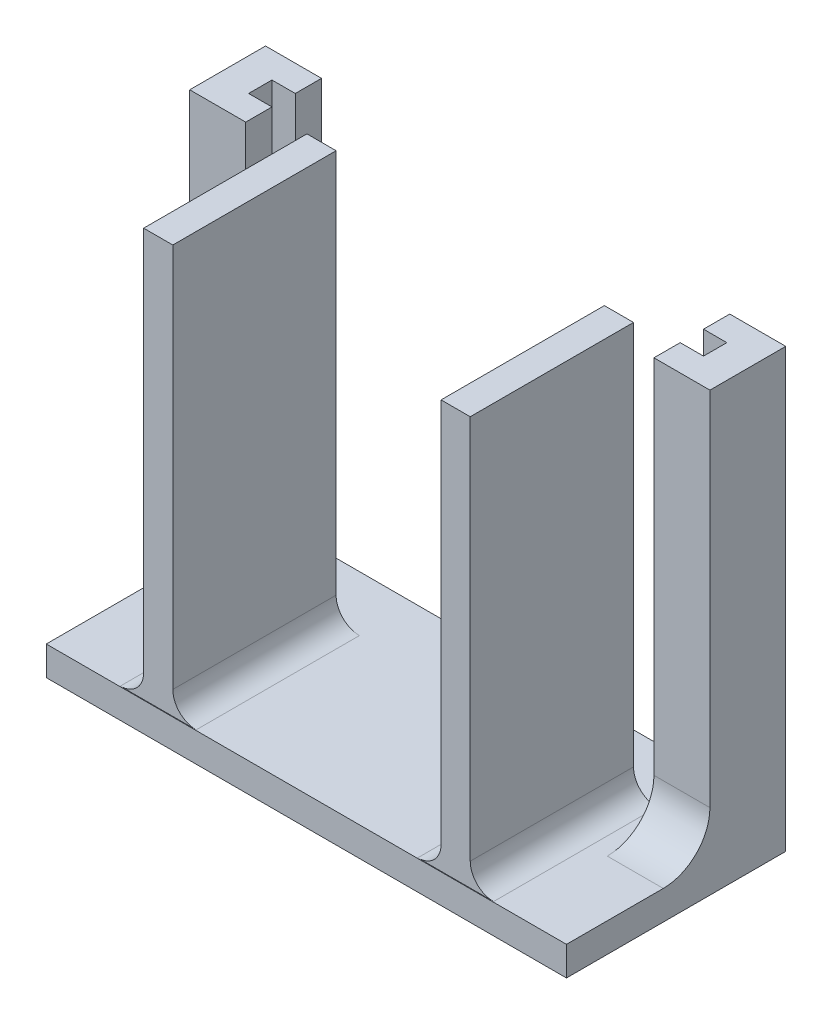
from build123d import *

# Parameters (mm, degrees)
BOSS_EXTRUDE1_DEPTH   = 35
BOSS_EXTRUDE1_2_DEPTH = 35
SKETCH1_W             = 2.5
SKETCH1_H             = 14
BOSS_EXTRUDE1_3_DEPTH = 35
BOSS_EXTRUDE1_4_DEPTH = 35
SKETCH2_W             = 44.6
SKETCH2_H             = 18.8
BOSS_EXTRUDE2_DEPTH   = 2.5
FILLET1_R             = 2
FILLET2_R             = 4


with BuildPart() as part:
    # Sketch1 → Boss-Extrude1 (new body)
    with BuildSketch(Plane(origin=(0, -19, 0), x_dir=(1, 0, 0), z_dir=(0, 1, 0))):
        Polygon((-19.5, 0.5), (-17.5, 0.5), (-17.5, 2.75), (-22.3, 2.75), (-22.3, -3.75), (-17.5, -3.75), (-17.5, -1.5), (-19.5, -1.5), align=None)
    extrude(amount=BOSS_EXTRUDE1_DEPTH)



with BuildPart() as body_2:
    # Sketch1 → Boss-Extrude1 2 (new body)
    with BuildSketch(Plane(origin=(0, -19, 0), x_dir=(1, 0, 0), z_dir=(0, 1, 0))):
        Polygon((19.5, -1.5), (19.5, 0.5), (17.5, 0.5), (17.5, 2.75), (22.3, 2.75), (22.3, -3.75), (17.5, -3.75), (17.5, -1.5), align=None)
    extrude(amount=BOSS_EXTRUDE1_2_DEPTH)


with BuildPart() as body_3:
    # Sketch1 → Boss-Extrude1 3 (new body)
    with BuildSketch(Plane(origin=(0, -19, 0), x_dir=(1, 0, 0), z_dir=(0, 1, 0))):
        with Locations((12.75, -9)):
            Rectangle(SKETCH1_W, SKETCH1_H)
    extrude(amount=BOSS_EXTRUDE1_3_DEPTH)


with BuildPart() as body_4:
    # Sketch1 → Boss-Extrude1 4 (new body)
    with BuildSketch(Plane(origin=(0, -19, 0), x_dir=(1, 0, 0), z_dir=(0, 1, 0))):
        with Locations((-12.75, -9)):
            Rectangle(SKETCH1_W, SKETCH1_H)
    extrude(amount=BOSS_EXTRUDE1_4_DEPTH)


with BuildPart() as part_1:
    add(part.part)

    add(body_2.part)  # Boss-Extrude2 merges body 2

    add(body_3.part)  # Boss-Extrude2 merges body 3

    add(body_4.part)  # Boss-Extrude2 merges body 4
    # Sketch2 → Boss-Extrude2 (add)
    with BuildSketch(Plane(origin=(0, -19, 0), x_dir=(1, 0, 0), z_dir=(0, 1, 0))):
        with Locations((0, -6.65)):
            Rectangle(SKETCH2_W, SKETCH2_H)
    extrude(amount=-BOSS_EXTRUDE2_DEPTH)

    # Fillet1
    fillet1_edges = [part_1.edges().sort_by_distance(p)[0] for p in [
        (-14, -19, 9),
        (11.5, -19, 9),
        (-11.5, -19, 9),
        (14, -19, 9),
    ]]
    fillet(fillet1_edges, radius=FILLET1_R)

    # Fillet2
    fillet2_edges = [part_1.edges().sort_by_distance(p)[0] for p in [
        (19.9, -19, 3.75),
        (-19.9, -19, 3.75),
    ]]
    fillet(fillet2_edges, radius=FILLET2_R)


solid = part_1.part
